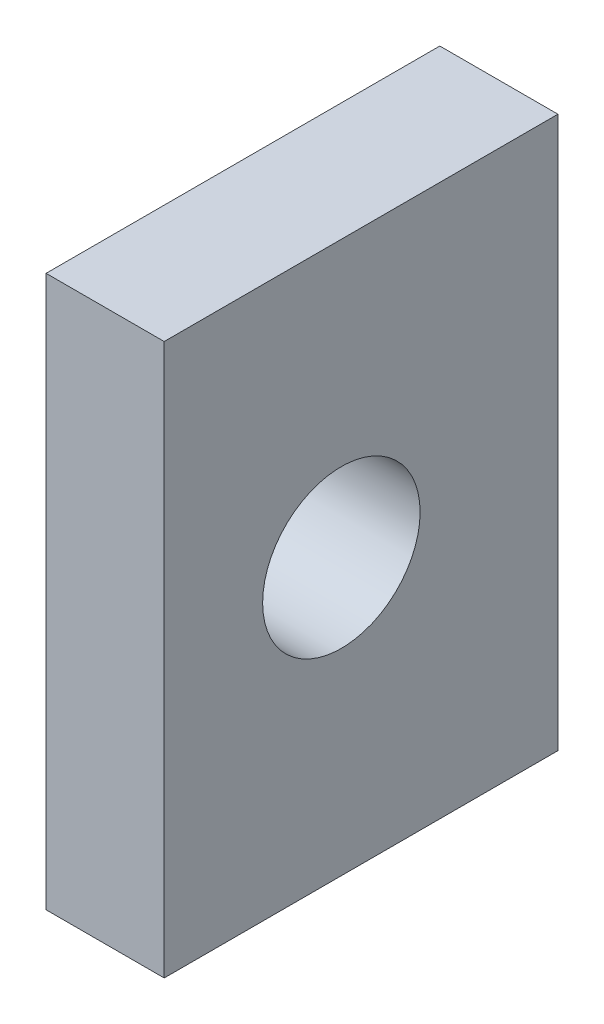
from build123d import *

# Parameters (mm, degrees)
SKETCH1_W           = 31.75
SKETCH1_H           = 44.45
SKETCH1_R           = 6.35
BOSS_EXTRUDE1_DEPTH = 9.525


with BuildPart() as part:
    # Sketch1 → Boss-Extrude1 (new body)
    with BuildSketch(Plane(origin=(0, 0, 0), x_dir=(0, 0, -1), z_dir=(1, 0, 0))):
        Rectangle(SKETCH1_W, SKETCH1_H)
        with Locations((-1.5875, 0)):
            Circle(SKETCH1_R, mode=Mode.SUBTRACT)
    extrude(amount=BOSS_EXTRUDE1_DEPTH)


solid = part.part
